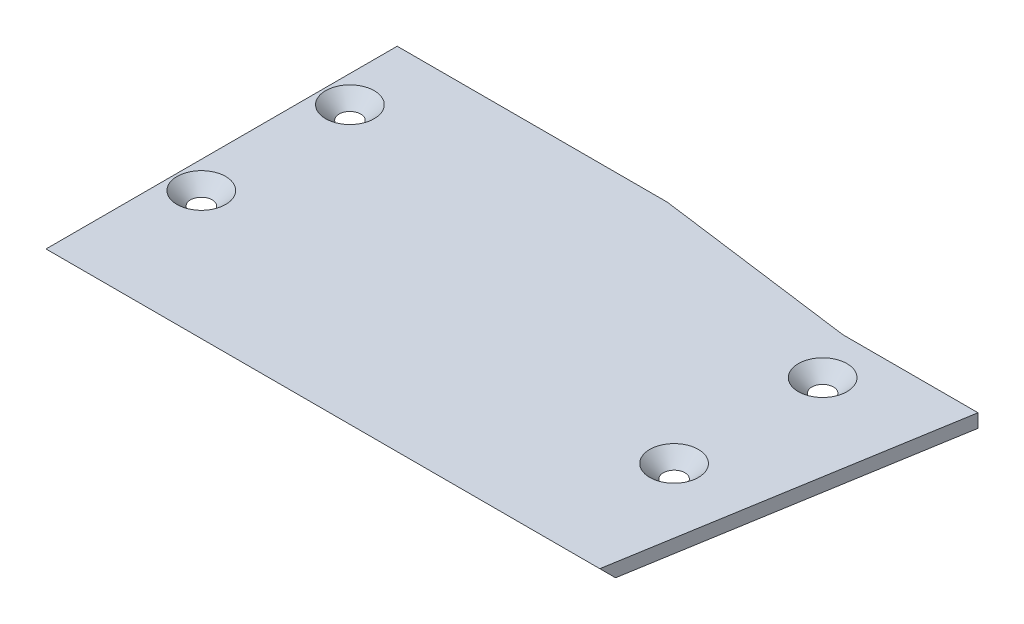
from build123d import *

# Parameters (mm, degrees)
BOSS_EXTRUDE1_DEPTH = 2
CHAMFER1_SIZE       = 2
SKETCH2_R           = 1.6
CUT_EXTRUDE1_DEPTH  = 103.019605959
CHAMFER2_SIZE       = 2


with BuildPart() as part:
    # Sketch1 → Boss-Extrude1 (new body)
    with BuildSketch(Plane(origin=(0, 0, 0), x_dir=(1, 0, 0), z_dir=(0, 1, 0))):
        Polygon((0, 0), (0, 4), (40, 4), (70, 0), (90, 0), (82, -48), (0, -48), align=None)
    extrude(amount=BOSS_EXTRUDE1_DEPTH)

    # Chamfer1
    chamfer1_edges = [part.edges().sort_by_distance(p)[0] for p in [
        (41, 0, 48),
    ]]
    chamfer(chamfer1_edges, length=CHAMFER1_SIZE - 0.0001)  # a hair under: the kernel refuses the full size

    # Sketch2 → Cut-Extrude1 (cut, through all)
    with BuildSketch(Plane(origin=(0, 2, 0), x_dir=(1, 0, 0), z_dir=(0, 1, 0))):
        with Locations(Location((4, -7, 0), (0, 0, 270))):
            Circle(SKETCH2_R)
        with Locations(Location((4, -29, 0), (0, 0, 270))):
            Circle(SKETCH2_R)
        with Locations(Location((74, -7, 0), (0, 0, 270))):
            Circle(SKETCH2_R)
        with Locations(Location((74, -29, 0), (0, 0, 270))):
            Circle(SKETCH2_R)
    extrude(amount=-CUT_EXTRUDE1_DEPTH, mode=Mode.SUBTRACT)

    # Chamfer2
    chamfer2_edges = [part.edges().sort_by_distance(p)[0] for p in [
        (4, 2, 27.4),
        (74, 2, 5.4),
        (74, 2, 27.4),
        (4, 2, 5.4),
    ]]
    chamfer(chamfer2_edges, length=CHAMFER2_SIZE - 0.0001)  # a hair under: the kernel refuses the full size


solid = part.part
